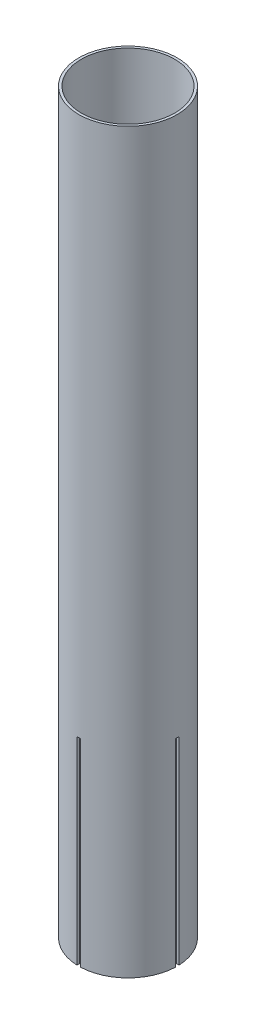
from build123d import *

# Parameters (mm, degrees)
SKETCH1_R           = 40
SKETCH1_R_2         = 38
BOSS_EXTRUDE1_DEPTH = 600
SKETCH2_W           = 3
SKETCH2_H           = 161
CUT_EXTRUDE1_DEPTH  = 603.660766933
CIRPATTERN1_COUNT   = 4


with BuildPart() as part:
    # Sketch1 → Boss-Extrude1 (new body)
    with BuildSketch(Plane(origin=(0, 0, 0), x_dir=(1, 0, 0), z_dir=(0, 1, 0))):
        Circle(SKETCH1_R)
        Circle(SKETCH1_R_2, mode=Mode.SUBTRACT)
    extrude(amount=BOSS_EXTRUDE1_DEPTH)

    # Sketch2 → Cut-Extrude1 (cut, through all)
    with BuildSketch(Plane(origin=(0, 0, 0), x_dir=(0, 0, -1), z_dir=(1, 0, 0))):
        with Locations((0, 80.5)):
            Rectangle(SKETCH2_W, SKETCH2_H)
    cut_extrude1 = extrude(amount=-CUT_EXTRUDE1_DEPTH, mode=Mode.SUBTRACT)

    # CirPattern1: Cut-Extrude1 ×4 about axis
    cirpattern1_axis = Axis((0, 600, 0), (0, -1, 0))
    for i in range(1, CIRPATTERN1_COUNT):
        add(cut_extrude1.rotate(cirpattern1_axis, i * 360 / CIRPATTERN1_COUNT), mode=Mode.SUBTRACT)


solid = part.part
